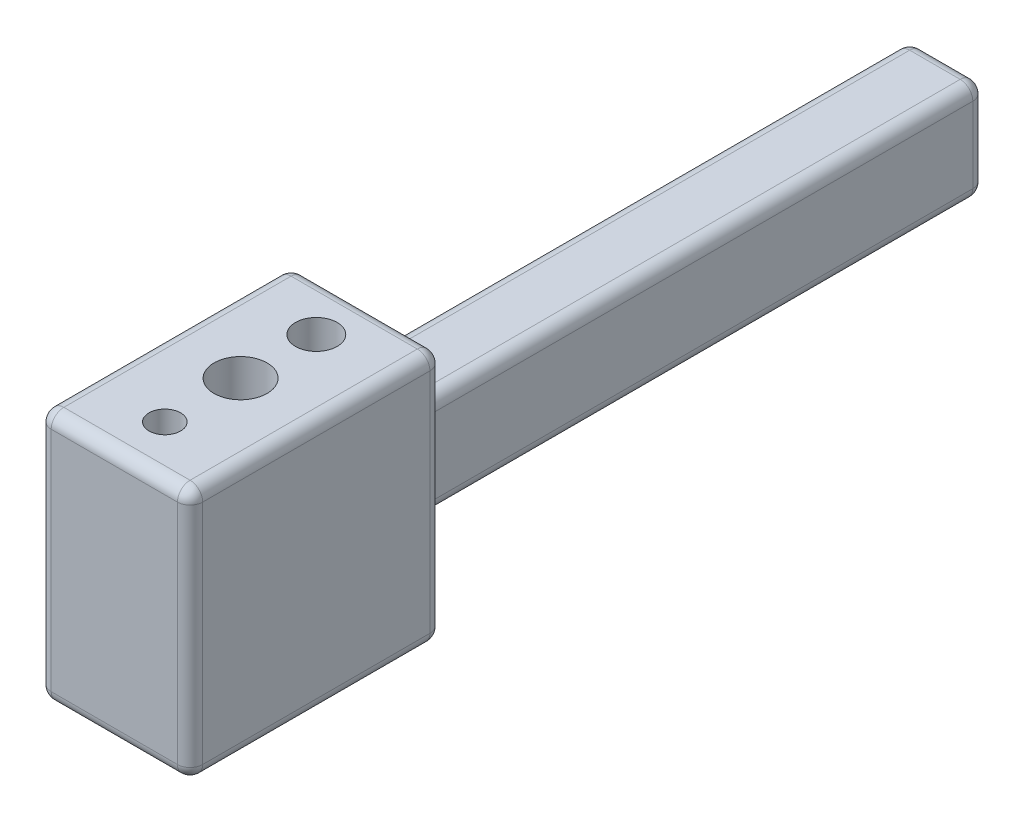
from build123d import *

# Parameters (mm, degrees)
EXTRUDE_1_DEPTH     = 46
EXTRUDE_2_OUTLINE_W = 12
EXTRUDE_2_OUTLINE_H = 20
EXTRUDE_2_DEPTH     = 20
FILLET_1_R          = 1
FILLET_2_R          = 1
FILLET_3_R          = 1
FILLET_4_R          = 1
FILLET_5_R          = 1
HOLE_WIZARD_M5_1_D  = 4.2
HOLE_WIZARD_M4_1_D  = 3.3
HOLE_WIZARD_M3_1_D  = 2.5


# Read off the part's stored shape, not the designer's step: 凸台-拉伸2
with BuildPart() as part:
    # 草图1 → 凸台-拉伸1 (new body)
    with BuildSketch(Plane.XY):
        with BuildLine():
            Line((-2, -4), (2, -4))
            ThreePointArc((2, -4), (2.707106781, -3.707106781), (3, -3))
            Line((3, -3), (3, 3))
            ThreePointArc((3, 3), (2.707106781, 3.707106781), (2, 4))
            Line((2, 4), (-2, 4))
            ThreePointArc((-2, 4), (-2.707106781, 3.707106781), (-3, 3))
            Line((-3, 3), (-3, -3))
            ThreePointArc((-3, -3), (-2.707106781, -3.707106781), (-2, -4))
        make_face()
    extrude(amount=EXTRUDE_1_DEPTH)

    # 凸台-拉伸2 outline → 凸台-拉伸2 (add)
    with BuildSketch(Plane.XY.offset(46)):
        Rectangle(EXTRUDE_2_OUTLINE_W, EXTRUDE_2_OUTLINE_H)
    extrude(amount=EXTRUDE_2_DEPTH)

    # 圆角1
    fillet_1_edges = [part.edges().sort_by_distance(p)[0] for p in [
        (6, -10, 56),
        (6, 10, 56),
        (-6, 10, 56),
        (-6, -10, 56),
    ]]
    fillet(fillet_1_edges, radius=FILLET_1_R)

    # 圆角2
    fillet_2_edges = [part.edges().sort_by_distance(p)[0] for p in [
        (2.707106781, -3.707106781, 46),
        (3, 0, 46),
        (2.707106781, 3.707106781, 46),
        (0, 4, 46),
        (-2.707106781, 3.707106781, 46),
        (-3, 0, 46),
        (-2.707106781, -3.707106781, 46),
        (0, -4, 46),
    ]]
    fillet(fillet_2_edges, radius=FILLET_2_R)

    # 圆角3
    fillet_3_edges = [part.edges().sort_by_distance(p)[0] for p in [
        (0, -10, 66),
        (-6, 0, 66),
        (6, 0, 66),
        (0, 10, 66),
        (-5.707106781, 9.707106781, 66),
        (5.707106781, 9.707106781, 66),
        (5.707106781, -9.707106781, 66),
        (-5.707106781, -9.707106781, 66),
    ]]
    fillet(fillet_3_edges, radius=FILLET_3_R)

    # 圆角4
    fillet_4_edges = [part.edges().sort_by_distance(p)[0] for p in [
        (0, -10, 46),
        (6, 0, 46),
        (-6, 0, 46),
        (0, 10, 46),
        (-5.707106781, 9.707106781, 46),
        (5.707106781, 9.707106781, 46),
        (5.707106781, -9.707106781, 46),
        (-5.707106781, -9.707106781, 46),
    ]]
    fillet(fillet_4_edges, radius=FILLET_4_R)

    # 圆角5
    fillet_5_edges = [part.edges().sort_by_distance(p)[0] for p in [
        (3, 0, 0),
        (2.707106781, -3.707106781, 0),
        (0, -4, 0),
        (-2.707106781, -3.707106781, 0),
        (-3, 0, 0),
        (-2.707106781, 3.707106781, 0),
        (0, 4, 0),
        (2.707106781, 3.707106781, 0),
    ]]
    fillet(fillet_5_edges, radius=FILLET_5_R)

    # M5 螺纹孔1 (through all)
    with Locations(Plane(origin=(0, 10, 0), x_dir=(1, 0, 0), z_dir=(0, 1, 0))):
        with Locations((0, -56)):
            Hole(HOLE_WIZARD_M5_1_D / 2)

    # M4 螺纹孔1 (through all)
    with Locations(Plane(origin=(0, 10, 0), x_dir=(1, 0, 0), z_dir=(0, 1, 0))):
        with Locations((0, -50)):
            Hole(HOLE_WIZARD_M4_1_D / 2)

    # M3 螺纹孔1 (through all)
    with Locations(Plane(origin=(0, 10, 0), x_dir=(1, 0, 0), z_dir=(0, 1, 0))):
        with Locations((0, -62)):
            Hole(HOLE_WIZARD_M3_1_D / 2)


solid = part.part
